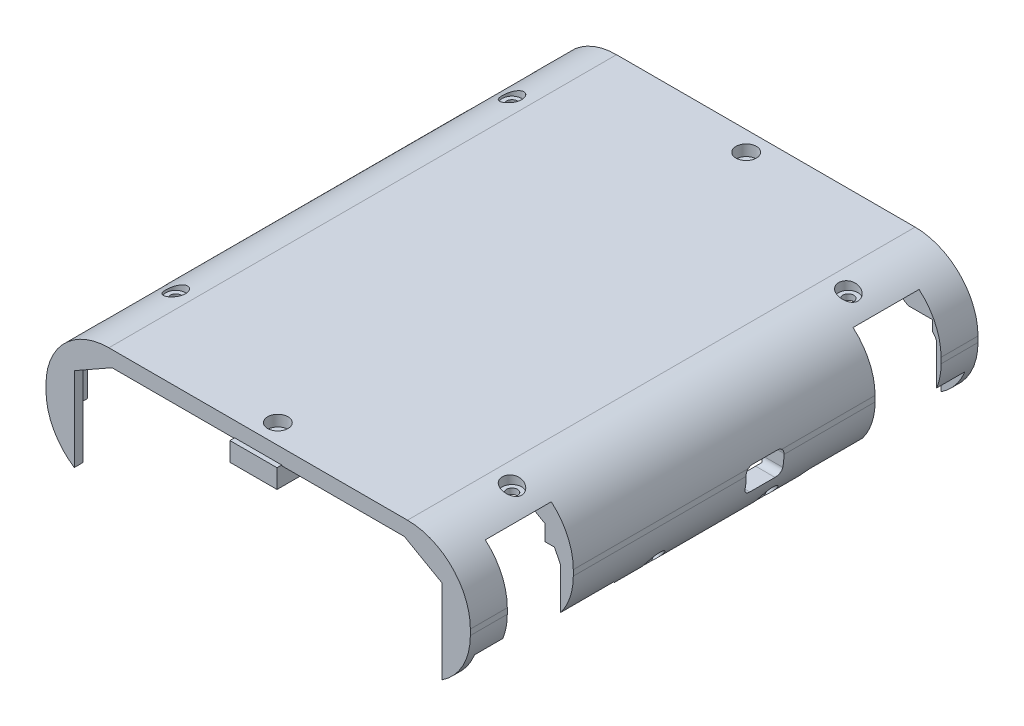
from build123d import *

# Parameters (mm, degrees)
BOSS_EXTRUDE1_DEPTH = 161.5
SKETCH11_W          = 21
SKETCH11_H          = 33.7
CUT_EXTRUDE7_DEPTH  = 214.141971465
CUT_EXTRUDE8_REACH  = 181.223
SKETCH12_R          = 1.75
SKETCH14_R          = 3.1
CUT_EXTRUDE9_DEPTH  = 3
CUT_EXTRUDE10_DEPTH = 9
BOSS_EXTRUDE5_DEPTH = 6
CUT_EXTRUDE11_REACH = 179.217
SKETCH20_R          = 1.75
SKETCH22_R          = 3.25
CUT_EXTRUDE12_DEPTH = 3.5
CUT_EXTRUDE13_START = -15
CUT_EXTRUDE13_DEPTH = 15
CHAMFER1_SIZE       = 7
MIRROR1_START       = -34
MIRROR1_OUTLINE_W   = 7.588235294
MIRROR1_OUTLINE_H   = 9
MIRROR1_DEPTH       = 18.20203721
MIRROR1_START_2     = -16.8
MIRROR1_2_OUTLINE_W = 6.338235294
MIRROR1_2_OUTLINE_H = 9
MIRROR1_2_DEPTH     = 10.8
MIRROR1_START_3     = 1.5
MIRROR1_3_OUTLINE_R = 3.25
MIRROR1_3_DEPTH     = 4.5
MIRROR1_4_OUTLINE_W = 1.25
MIRROR1_4_OUTLINE_H = 9
MIRROR1_4_DEPTH     = 5.4
MIRROR1_5_OUTLINE_R = 1.75
MIRROR1_5_DEPTH     = 1.5
MIRROR1_START_4     = -5.8
MIRROR1_6_OUTLINE_R = 1.75
MIRROR1_6_DEPTH     = 6
MIRROR1_START_5     = 32.75
MIRROR1_7_DEPTH     = 22
MIRROR1_START_6     = 149.75
MIRROR1_8_DEPTH     = 9
MIRROR1_START_7     = -15.79796279
MIRROR1_9_DEPTH     = 3.99796279
SKETCH24_W          = 32
SKETCH24_H          = 27
CUT_EXTRUDE14_DEPTH = 3
FILLET1_R           = 3
SKETCH25_W          = 8
SKETCH25_H          = 5
BOSS_EXTRUDE6_DEPTH = 8
CUT_EXTRUDE15_REACH = 119.19
CUT_EXTRUDE17_REACH = 216.281
SKETCH27_R          = 1.6
SKETCH28_R          = 3
CUT_EXTRUDE18_DEPTH = 7
SKETCH31_W          = 42
SKETCH31_H          = 65
CUT_EXTRUDE19_DEPTH = 6.8
SKETCH34_R          = 3
SKETCH34_W          = 6
SKETCH34_H          = 8.65
BOSS_EXTRUDE7_DEPTH = 3.5
SKETCH37_R          = 1.05
CUT_EXTRUDE21_DEPTH = 6.2
CUT_EXTRUDE22_DEPTH = 2
CUT_EXTRUDE23_REACH = 210.728
SKETCH40_W          = 12
SKETCH40_H          = 8
CHAMFER2_SIZE       = 2
FILLET2_R           = 2
SKETCH41_W          = 50
SKETCH41_H          = 4
SKETCH41_H_2        = 10
CUT_EXTRUDE24_DEPTH = 3.5
FILLET3_R           = 3.5
SKETCH43_R          = 3.5
BOSS_EXTRUDE8_DEPTH = 3
CUT_EXTRUDE28_REACH = 184.576
CUT_EXTRUDE28_START = 3
SKETCH48_W          = 11.5
SKETCH48_H          = 72
SKETCH44_R          = 2
CUT_EXTRUDE26_DEPTH = 5
CUT_EXTRUDE27_REACH = 210.728
SKETCH45_W          = 20
SKETCH45_H          = 8
CHAMFER3_SIZE       = 2
FILLET4_R           = 2
SKETCH46_R          = 2.75
SKETCH46_R_2        = 2.1
BOSS_EXTRUDE9_DEPTH = 2.3


with BuildPart() as part:
    # Sketch9 → Boss-Extrude1 (new body)
    with BuildSketch(Plane.XY):
        with BuildLine():
            Line((-47.5, 5), (47.5, 5))
            ThreePointArc((47.5, 5), (61.642135624, -0.857864376), (67.5, -15))
            Line((67.5, -15), (67.5, -16.8))
            ThreePointArc((67.5, -16.8), (65.106767147, -26.285383493), (58.5, -33.5))
            Line((58.5, -33.5), (58.5, -6.8))
            Line((58.5, -6.8), (46.5, 0))
            Line((46.5, 0), (-46.5, 0))
            Line((-46.5, 0), (-58.5, -6.8))
            Line((-58.5, -6.8), (-58.5, -33.5))
            ThreePointArc((-58.5, -33.5), (-65.106767147, -26.285383493), (-67.5, -16.8))
            Line((-67.5, -16.8), (-67.5, -15))
            ThreePointArc((-67.5, -15), (-61.642135624, -0.857864376), (-47.5, 5))
        make_face()
    extrude(amount=BOSS_EXTRUDE1_DEPTH)

    # Sketch11 → Cut-Extrude7 (cut, through all)
    with BuildSketch(Plane.ZY.offset(67.5)):
        with Locations((139.25, -16.65)):
            Rectangle(SKETCH11_W, SKETCH11_H)
        with Locations((22.25, -16.65)):
            Rectangle(SKETCH11_W, SKETCH11_H)
    extrude(amount=-CUT_EXTRUDE7_DEPTH, mode=Mode.SUBTRACT)

    # Sketch12 → Cut-Extrude8 (cut, up to next)
    with BuildSketch(Plane(origin=(0, 5, 0), x_dir=(1, 0, 0), z_dir=(0, 1, 0)), mode=Mode.PRIVATE) as cut_extrude8_sk1:
        with Locations(Location((-53.5, -134.25, 0), (0, 0, 270))):
            Circle(SKETCH12_R)
    cut_extrude8_tool1 = extrude(cut_extrude8_sk1.sketch, amount=-CUT_EXTRUDE8_REACH, mode=Mode.PRIVATE) & part.part
    # Sketch12 → Cut-Extrude8 (cut, up to next)
    with BuildSketch(Plane(origin=(0, 5, 0), x_dir=(1, 0, 0), z_dir=(0, 1, 0)), mode=Mode.PRIVATE) as cut_extrude8_sk2:
        with Locations(Location((-53.5, -27.25, 0), (0, 0, 270))):
            Circle(SKETCH12_R)
    cut_extrude8_tool2 = extrude(cut_extrude8_sk2.sketch, amount=-CUT_EXTRUDE8_REACH, mode=Mode.PRIVATE) & part.part
    # Sketch12 → Cut-Extrude8 (cut, up to next)
    with BuildSketch(Plane(origin=(0, 5, 0), x_dir=(1, 0, 0), z_dir=(0, 1, 0)), mode=Mode.PRIVATE) as cut_extrude8_sk3:
        with Locations(Location((53.5, -27.25, 0), (0, 0, 270))):
            Circle(SKETCH12_R)
    cut_extrude8_tool3 = extrude(cut_extrude8_sk3.sketch, amount=-CUT_EXTRUDE8_REACH, mode=Mode.PRIVATE) & part.part
    # Sketch12 → Cut-Extrude8 (cut, up to next)
    with BuildSketch(Plane(origin=(0, 5, 0), x_dir=(1, 0, 0), z_dir=(0, 1, 0)), mode=Mode.PRIVATE) as cut_extrude8_sk4:
        with Locations(Location((53.5, -134.25, 0), (0, 0, 270))):
            Circle(SKETCH12_R)
    cut_extrude8_tool4 = extrude(cut_extrude8_sk4.sketch, amount=-CUT_EXTRUDE8_REACH, mode=Mode.PRIVATE) & part.part
    add(cut_extrude8_tool1.solids().sort_by_distance((-53.5, 5, 134.25))[0], mode=Mode.SUBTRACT)
    add(cut_extrude8_tool2.solids().sort_by_distance((-53.5, 5, 27.25))[0], mode=Mode.SUBTRACT)
    add(cut_extrude8_tool3.solids().sort_by_distance((53.5, 5, 27.25))[0], mode=Mode.SUBTRACT)
    add(cut_extrude8_tool4.solids().sort_by_distance((53.5, 5, 134.25))[0], mode=Mode.SUBTRACT)

    # Sketch14 → Cut-Extrude9 (cut)
    with BuildSketch(Plane(origin=(0, 5, 0), x_dir=(1, 0, 0), z_dir=(0, 1, 0))):
        with Locations(Location((-53.5, -134.25, 0), (0, 0, 270))):
            Circle(SKETCH14_R)
        with Locations(Location((-53.5, -27.25, 0), (0, 0, 270))):
            Circle(SKETCH14_R)
        with Locations(Location((53.5, -27.25, 0), (0, 0, 270))):
            Circle(SKETCH14_R)
        with Locations(Location((53.5, -134.25, 0), (0, 0, 270))):
            Circle(SKETCH14_R)
    extrude(amount=-CUT_EXTRUDE9_DEPTH, mode=Mode.SUBTRACT)

    # Sketch16 → Cut-Extrude10 (cut)
    with BuildSketch(Plane.XY.offset(11.75)):
        with BuildLine():
            Line((57.088235294, -33.5), (66.088235294, -33.5))
            Line((66.088235294, -33.5), (66.088235294, -11.4))
            ThreePointArc((66.088235294, -11.4), (65.636772566, -10.291539205), (64.838235294, -9.4))
            Line((64.838235294, -9.4), (64.838235294, -6))
            Line((64.838235294, -6), (57.088235294, -6))
            Line((57.088235294, -6), (57.088235294, -33.5))
        make_face()
        with BuildLine():
            Line((-66.088235294, -33.5), (-66.088235294, -11.4))
            ThreePointArc((-66.088235294, -11.4), (-65.636772566, -10.291539205), (-64.838235294, -9.4))
            Line((-64.838235294, -9.4), (-64.838235294, -6))
            Line((-64.838235294, -6), (-57.088235294, -6))
            Line((-57.088235294, -6), (-57.088235294, -33.5))
            Line((-57.088235294, -33.5), (-66.088235294, -33.5))
        make_face()
    extrude(amount=-CUT_EXTRUDE10_DEPTH, mode=Mode.SUBTRACT)

    # Sketch19 → Boss-Extrude5 (add)
    with BuildSketch(Plane.XZ.offset(-0.2)):
        Polygon((-11.248461447, 25.25), (11.251538553, 25.25), (11.251538553, 12.25), (7.501538553, 12.25), (7.501538553, -1.5), (-7.498461447, -1.5), (-7.498461447, 12.25), (-11.248461447, 12.25), align=None)
    extrude(amount=BOSS_EXTRUDE5_DEPTH)

    # Sketch20 → Cut-Extrude11 (cut, up to next)
    with BuildSketch(Plane.XZ.offset(5.8), mode=Mode.PRIVATE) as cut_extrude11_sk1:
        with Locations(Location((0.001538553, 6.25, 0), (0, 0, 270))):
            Circle(SKETCH20_R)
    cut_extrude11_tool1 = extrude(cut_extrude11_sk1.sketch, amount=-CUT_EXTRUDE11_REACH, mode=Mode.PRIVATE) & part.part
    add(cut_extrude11_tool1.solids().sort_by_distance((0.001539, -5.8, 6.25))[0], mode=Mode.SUBTRACT)

    # Sketch22 → Cut-Extrude12 (cut)
    with BuildSketch(Plane(origin=(0, 5, 0), x_dir=(1, 0, 0), z_dir=(0, 1, 0))):
        with Locations(Location((0.001538553, -6.25, 0), (0, 0, 270))):
            Circle(SKETCH22_R)
    extrude(amount=-CUT_EXTRUDE12_DEPTH, mode=Mode.SUBTRACT)

    # Sketch23 → Cut-Extrude13 (cut)
    with BuildSketch(Plane.XY.offset(128.75).offset(CUT_EXTRUDE13_START)):
        with BuildLine():
            Line((-58.5, -11.8), (-58.5, -33.5))
            ThreePointArc((-58.5, -33.5), (-61.203275994, -31.365138759), (-63.5, -28.79796279))
            Line((-63.5, -28.79796279), (-63.5, -15.79796279))
            Line((-63.5, -15.79796279), (-61.5, -11.8))
            Line((-61.5, -11.8), (-58.5, -11.8))
        make_face()
        with BuildLine():
            Line((63.5, -15.79796279), (63.5, -28.79796279))
            ThreePointArc((63.5, -28.79796279), (61.203275994, -31.365138759), (58.5, -33.5))
            Line((58.5, -33.5), (58.5, -11.8))
            Line((58.5, -11.8), (61.5, -11.8))
            Line((61.5, -11.8), (63.5, -15.79796279))
        make_face()
    extrude(amount=CUT_EXTRUDE13_DEPTH, mode=Mode.SUBTRACT)

    # Chamfer1
    # the kernel refuses this chamfer: 7 mm, written as the material it takes off along each edge
    with BuildSketch(Plane(origin=(-58.5, -11.8, 113.75), x_dir=(0, 0, -1), z_dir=(0, -1, 0))) as chamfer1_piece_1_section:
        Polygon((CHAMFER1_SIZE, 0), (0, -CHAMFER1_SIZE), (0, 0), align=None)
    chamfer1_piece_1 = extrude(amount=39.701780916, mode=Mode.PRIVATE)
    chamfer1_piece_1 = split(chamfer1_piece_1, bisect_by=Plane(origin=(-60.899510796, -10.599633252, 113.75), z_dir=(0.8943360284912045, -0.4473958740786281, 0)), keep=Keep.TOP, mode=Mode.PRIVATE)
    chamfer1_piece_1 = split(chamfer1_piece_1, bisect_by=Plane(origin=(-63.5, -11.8, 113.75), z_dir=(1, 0, 0)), keep=Keep.TOP, mode=Mode.PRIVATE)
    add(chamfer1_piece_1, mode=Mode.SUBTRACT)
    with BuildSketch(Plane(origin=(58.5, -51.501780916, 113.75), x_dir=(0, 0, -1), z_dir=(0, 1, 0))) as chamfer1_piece_2_section:
        Polygon((CHAMFER1_SIZE, 0), (0, -CHAMFER1_SIZE), (0, 0), align=None)
    chamfer1_piece_2 = extrude(amount=39.701780916, mode=Mode.PRIVATE)
    chamfer1_piece_2 = split(chamfer1_piece_2, bisect_by=Plane(origin=(63.5, -51.501780916, 113.75), z_dir=(-1, 0, 0)), keep=Keep.TOP, mode=Mode.PRIVATE)
    chamfer1_piece_2 = split(chamfer1_piece_2, bisect_by=Plane(origin=(76.785076672, -42.354583889, 113.75), z_dir=(-0.8943360284912032, -0.4473958740786306, 0)), keep=Keep.TOP, mode=Mode.PRIVATE)
    add(chamfer1_piece_2, mode=Mode.SUBTRACT)

    # Mirror1: read off the stored shape, not the designer's step
    # Mirror1 outline → Mirror1 (cut)
    with BuildSketch(Plane(origin=(0, 0, 0), x_dir=(1, 0, 0), z_dir=(0, 1, 0)).offset(MIRROR1_START)):
        with Locations((62.294117647, -154.25)):
            Rectangle(MIRROR1_OUTLINE_W, MIRROR1_OUTLINE_H)
        with Locations((-62.294117647, -154.25)):
            Rectangle(MIRROR1_OUTLINE_W, MIRROR1_OUTLINE_H)
        Polygon((-58.5, -54.75), (-58.5, -32.75), (-63.5, -32.75), (-63.5, -49.75), align=None)
        Polygon((63.5, -49.75), (63.5, -32.75), (58.5, -32.75), (58.5, -54.75), align=None)
    extrude(amount=MIRROR1_DEPTH, mode=Mode.SUBTRACT)

    # Mirror1 2 outline → Mirror1 2 (cut)
    with BuildSketch(Plane(origin=(0, 0, 0), x_dir=(1, 0, 0), z_dir=(0, 1, 0)).offset(MIRROR1_START_2)):
        with Locations((61.669117647, -154.25)):
            Rectangle(MIRROR1_2_OUTLINE_W, MIRROR1_2_OUTLINE_H)
        with Locations((-61.669117647, -154.25)):
            Rectangle(MIRROR1_2_OUTLINE_W, MIRROR1_2_OUTLINE_H)
    extrude(amount=MIRROR1_2_DEPTH, mode=Mode.SUBTRACT)

    # Mirror1 3 outline → Mirror1 3 (cut)
    with BuildSketch(Plane(origin=(0, 0, 0), x_dir=(1, 0, 0), z_dir=(0, 1, 0)).offset(MIRROR1_START_3)):
        with Locations((0.001538553, -155.25)):
            Circle(MIRROR1_3_OUTLINE_R)
    extrude(amount=MIRROR1_3_DEPTH, mode=Mode.SUBTRACT)

    # Mirror1 4 outline → Mirror1 4 (cut)
    with BuildSketch(Plane(origin=(0, 0, 0), x_dir=(1, 0, 0), z_dir=(0, 1, 0)).offset(MIRROR1_START_2)):
        with Locations((-65.463235294, -154.25)):
            Rectangle(MIRROR1_4_OUTLINE_W, MIRROR1_4_OUTLINE_H)
        with Locations((65.463235294, -154.25)):
            Rectangle(MIRROR1_4_OUTLINE_W, MIRROR1_4_OUTLINE_H)
    extrude(amount=MIRROR1_4_DEPTH, mode=Mode.SUBTRACT)

    # Mirror1 5 outline → Mirror1 5 (cut)
    with BuildSketch(Plane(origin=(0, 0, 0), x_dir=(1, 0, 0), z_dir=(0, 1, 0))):
        with Locations((0.001538553, -155.25)):
            Circle(MIRROR1_5_OUTLINE_R)
    extrude(amount=MIRROR1_5_DEPTH, mode=Mode.SUBTRACT)

    # Mirror1 6 outline → Mirror1 6 (add)
    with BuildSketch(Plane(origin=(0, 0, 0), x_dir=(1, 0, 0), z_dir=(0, 1, 0)).offset(MIRROR1_START_4)):
        Polygon((-7.498461447, -149.25), (-7.498461447, -163), (7.501538553, -163), (7.501538553, -149.25), (11.251538553, -149.25), (11.251538553, -136.25), (-11.248461447, -136.25), (-11.248461447, -149.25), align=None)
        with Locations((0.001538553, -155.25)):
            Circle(MIRROR1_6_OUTLINE_R, mode=Mode.SUBTRACT)
    extrude(amount=MIRROR1_6_DEPTH)

    # Mirror1 7 outline → Mirror1 7 (cut)
    with BuildSketch(Plane.XY.offset(MIRROR1_START_5)):
        Polygon((-58.5, -15.79796279), (-58.5, -11.8), (-61.5, -11.8), (-63.5, -15.79796279), align=None)
        Polygon((61.5, -11.8), (58.5, -11.8), (58.5, -15.79796279), (63.5, -15.79796279), align=None)
    extrude(amount=MIRROR1_7_DEPTH, mode=Mode.SUBTRACT)

    # Mirror1 8 outline → Mirror1 8 (cut)
    with BuildSketch(Plane.XY.offset(MIRROR1_START_6)):
        Polygon((-57.088235294, -6), (-58.5, -6), (-58.5, -6.8), align=None)
        with BuildLine():
            ThreePointArc((-64.838235294, -9.4), (-65.636772566, -10.291539205), (-66.088235294, -11.4))
            Line((-66.088235294, -11.4), (-64.838235294, -11.4))
            Line((-64.838235294, -11.4), (-64.838235294, -9.4))
        make_face()
        with BuildLine():
            ThreePointArc((66.088235294, -11.4), (65.636772566, -10.291539205), (64.838235294, -9.4))
            Line((64.838235294, -9.4), (64.838235294, -11.4))
            Line((64.838235294, -11.4), (66.088235294, -11.4))
        make_face()
        Polygon((58.5, -6), (57.088235294, -6), (58.5, -6.8), align=None)
    extrude(amount=MIRROR1_8_DEPTH, mode=Mode.SUBTRACT)

    # Mirror1 9 outline → Mirror1 9 (add)
    with BuildSketch(Plane(origin=(0, 0, 0), x_dir=(1, 0, 0), z_dir=(0, 1, 0)).offset(MIRROR1_START_7)):
        Polygon((65, -48.25), (58.5, -54.75), (65, -54.75), align=None)
        Polygon((-58.5, -54.75), (-65, -48.25), (-65, -54.75), align=None)
    extrude(amount=MIRROR1_9_DEPTH)

    # Sketch24 → Cut-Extrude14 (cut)
    with BuildSketch(Plane.XZ):
        with Locations((0, 86.75)):
            Rectangle(SKETCH24_W, SKETCH24_H)
    extrude(amount=-CUT_EXTRUDE14_DEPTH, mode=Mode.SUBTRACT)

    # Fillet1
    fillet1_edges = [part.edges().sort_by_distance(p)[0] for p in [
        (-16, 3, 86.75),
        (16, 3, 86.75),
    ]]
    fillet(fillet1_edges, radius=FILLET1_R - 0.0001)  # a hair under: the kernel refuses the full size

    # Sketch25 → Boss-Extrude6 (add)
    with BuildSketch(Plane.XZ):
        with Locations((17, 70.75)):
            Rectangle(SKETCH25_W, SKETCH25_H)
        with Locations((-17, 70.75)):
            Rectangle(SKETCH25_W, SKETCH25_H)
    boss_extrude6 = extrude(amount=BOSS_EXTRUDE6_DEPTH)

    # Sketch26 → Cut-Extrude15 (cut, up to next)
    with BuildSketch(Plane.XY.offset(73.25), mode=Mode.PRIVATE) as cut_extrude15_sk1:
        Polygon((21, -1), (21, -8), (15.5, -8), align=None)
    cut_extrude15_tool1 = extrude(cut_extrude15_sk1.sketch, amount=-CUT_EXTRUDE15_REACH, mode=Mode.PRIVATE) & part.part
    # Sketch26 → Cut-Extrude15 (cut, up to next)
    with BuildSketch(Plane.XY.offset(73.25), mode=Mode.PRIVATE) as cut_extrude15_sk2:
        Polygon((-15.5, -8), (-21, -1), (-21, -8), align=None)
    cut_extrude15_tool2 = extrude(cut_extrude15_sk2.sketch, amount=-CUT_EXTRUDE15_REACH, mode=Mode.PRIVATE) & part.part
    cut_extrude15_1 = cut_extrude15_tool1.solids().sort_by_distance((19.166667, -5.666667, 73.25))[0]
    add(cut_extrude15_1, mode=Mode.SUBTRACT)
    cut_extrude15_2 = cut_extrude15_tool2.solids().sort_by_distance((-19.166667, -5.666667, 73.25))[0]
    add(cut_extrude15_2, mode=Mode.SUBTRACT)
    cut_extrude15 = cut_extrude15_1 + cut_extrude15_2  # Cut-Extrude15 as one shape, for the pattern or mirror that repeats it

    # Mirror2: Boss-Extrude6, Cut-Extrude15 across plane
    add(boss_extrude6.mirror(Plane.XY.offset(86.75)))
    add(cut_extrude15.mirror(Plane.XY.offset(86.75)), mode=Mode.SUBTRACT)

    # Sketch27 → Cut-Extrude17 (cut, up to next)
    with BuildSketch(Plane(origin=(67.5, 0, 0), x_dir=(0, 0, -1), z_dir=(1, 0, 0)), mode=Mode.PRIVATE) as cut_extrude17_sk1:
        with Locations(Location((-98.75, -29.5, 0), (0, 0, 90))):
            Circle(SKETCH27_R)
    cut_extrude17_tool1 = extrude(cut_extrude17_sk1.sketch, amount=-CUT_EXTRUDE17_REACH, mode=Mode.PRIVATE) & part.part
    # Sketch27 → Cut-Extrude17 (cut, up to next)
    with BuildSketch(Plane(origin=(67.5, 0, 0), x_dir=(0, 0, -1), z_dir=(1, 0, 0)), mode=Mode.PRIVATE) as cut_extrude17_sk2:
        with Locations(Location((-62.75, -29.5, 0), (0, 0, 90))):
            Circle(SKETCH27_R)
    cut_extrude17_tool2 = extrude(cut_extrude17_sk2.sketch, amount=-CUT_EXTRUDE17_REACH, mode=Mode.PRIVATE) & part.part
    cut_extrude17_1 = cut_extrude17_tool1.solids().sort_by_distance((67.5, -29.5, 98.75))[0]
    add(cut_extrude17_1, mode=Mode.SUBTRACT)
    cut_extrude17_2 = cut_extrude17_tool2.solids().sort_by_distance((67.5, -29.5, 62.75))[0]
    add(cut_extrude17_2, mode=Mode.SUBTRACT)
    cut_extrude17 = cut_extrude17_1 + cut_extrude17_2  # Cut-Extrude17 as one shape, for the pattern or mirror that repeats it

    # Sketch28 → Cut-Extrude18 (cut)
    with BuildSketch(Plane(origin=(67.5, 0, 0), x_dir=(0, 0, -1), z_dir=(1, 0, 0))):
        with Locations((-98.75, -29.5)):
            Circle(SKETCH28_R)
        with Locations((-62.75, -29.5)):
            Circle(SKETCH28_R)
    cut_extrude18 = extrude(amount=-CUT_EXTRUDE18_DEPTH, mode=Mode.SUBTRACT)

    # Mirror3: Cut-Extrude17, Cut-Extrude18 across plane
    add(cut_extrude17.mirror(Plane(origin=(0, 0, 0), x_dir=(0, 0, 1), z_dir=(1, 0, 0))), mode=Mode.SUBTRACT)
    add(cut_extrude18.mirror(Plane(origin=(0, 0, 0), x_dir=(0, 0, 1), z_dir=(1, 0, 0))), mode=Mode.SUBTRACT)

    # Sketch31 → Cut-Extrude19 (cut)
    with BuildSketch(Plane.XZ):
        with Locations((37.5, 80.75)):
            Rectangle(SKETCH31_W, SKETCH31_H)
    extrude(amount=CUT_EXTRUDE19_DEPTH, mode=Mode.SUBTRACT)

    # Sketch34 → Boss-Extrude7 (add)
    with BuildSketch(Plane.XZ):
        with Locations(Location((19.5, 108.6, 0), (0, 0, 90))):
            Circle(SKETCH34_R)
        with Locations(Location((19.5, 52.9, 0), (0, 0, 90))):
            Circle(SKETCH34_R)
        with Locations((55.5, 108.925)):
            Rectangle(SKETCH34_W, SKETCH34_H)
        with Locations((55.5, 52.575)):
            Rectangle(SKETCH34_W, SKETCH34_H)
    extrude(amount=BOSS_EXTRUDE7_DEPTH)

    # Sketch37 → Cut-Extrude21 (cut)
    with BuildSketch(Plane.XZ.offset(3.5)):
        with Locations(Location((19.5, 108.6, 0), (0, 0, 270))):
            Circle(SKETCH37_R)
        with Locations(Location((19.5, 52.9, 0), (0, 0, 270))):
            Circle(SKETCH37_R)
        with Locations(Location((55.549682172, 108.6, 0), (0, 0, 270))):
            Circle(SKETCH37_R)
        with Locations(Location((55.549682172, 52.9, 0), (0, 0, 270))):
            Circle(SKETCH37_R)
    extrude(amount=-CUT_EXTRUDE21_DEPTH, mode=Mode.SUBTRACT)

    # Sketch38 → Cut-Extrude22 (cut)
    with BuildSketch(Plane.XZ):
        with BuildLine():
            Line((21.632580596, 110.71), (18.281790932, 110.71))
            Line((18.281790932, 110.71), (17.063581864, 108.6))
            Line((17.063581864, 108.6), (18.281790932, 106.49))
            Line((18.281790932, 106.49), (21.632580596, 106.49))
            ThreePointArc((21.632580596, 106.49), (22.5, 108.6), (21.632580596, 110.71))
        make_face()
        Polygon((56.76789124, 106.49), (52.5, 106.49), (52.5, 110.71), (56.76789124, 110.71), (57.986100308, 108.6), align=None)
        Polygon((52.5, 50.79), (56.76789124, 50.79), (57.986100308, 52.9), (56.76789124, 55.01), (52.5, 55.01), align=None)
        with BuildLine():
            Line((18.281790932, 55.01), (21.632580596, 55.01))
            ThreePointArc((21.632580596, 55.01), (22.5, 52.9), (21.632580596, 50.79))
            Line((21.632580596, 50.79), (18.281790932, 50.79))
            Line((18.281790932, 50.79), (17.063581864, 52.9))
            Line((17.063581864, 52.9), (18.281790932, 55.01))
        make_face()
    extrude(amount=CUT_EXTRUDE22_DEPTH, mode=Mode.SUBTRACT)

    # Sketch40 → Cut-Extrude23 (cut, up to next)
    with BuildSketch(Plane.ZY.offset(-58.5), mode=Mode.PRIVATE) as cut_extrude23_sk1:
        with Locations((67.75, -18.5)):
            Rectangle(SKETCH40_W, SKETCH40_H)
    cut_extrude23_tool1 = extrude(cut_extrude23_sk1.sketch, amount=-CUT_EXTRUDE23_REACH, mode=Mode.PRIVATE) & part.part
    add(cut_extrude23_tool1.solids().sort_by_distance((58.5, -18.5, 67.75))[0], mode=Mode.SUBTRACT)

    # Chamfer2
    chamfer2_edges = [part.edges().sort_by_distance(p)[0] for p in [
        (58.5, -18.5, 73.75),
        (58.5, -14.5, 67.75),
        (58.5, -18.5, 61.75),
        (58.5, -22.5, 67.75),
    ]]
    chamfer(chamfer2_edges, length=CHAMFER2_SIZE)

    # Fillet2
    fillet2_edges = [part.edges().sort_by_distance(p)[0] for p in [
        (63.996874512, -14.5, 73.75),
        (63.585142918, -22.5, 73.75),
        (63.585142918, -22.5, 61.75),
        (63.996874512, -14.5, 61.75),
    ]]
    fillet(fillet2_edges, radius=FILLET2_R)

    # Sketch41 → Cut-Extrude24 (cut)
    with BuildSketch(Plane.XZ):
        with Locations((0, 120.75)):
            Rectangle(SKETCH41_W, SKETCH41_H)
        with Locations((0, 113.75)):
            Rectangle(SKETCH41_W, SKETCH41_H)
        with Locations((0, 41.25)):
            Rectangle(SKETCH41_W, SKETCH41_H_2)
    extrude(amount=-CUT_EXTRUDE24_DEPTH, mode=Mode.SUBTRACT)

    # Fillet3
    fillet3_edges = [part.edges().sort_by_distance(p)[0] for p in [
        (-25, 3.5, 113.75),
        (-25, 3.5, 120.75),
        (25, 3.5, 113.75),
        (25, 3.5, 120.75),
    ]]
    fillet(fillet3_edges, radius=FILLET3_R - 0.0001)  # a hair under: the kernel refuses the full size

    # Sketch43 → Boss-Extrude8 (add)
    with BuildSketch(Plane.XZ):
        with Locations((-54.5, 111.75)):
            Circle(SKETCH43_R)
        with Locations((-54.5, 49.75)):
            Circle(SKETCH43_R)
        with Locations(Location((-23.6, 49.75, 0), (0, 0, 270))):
            Circle(SKETCH43_R)
    extrude(amount=BOSS_EXTRUDE8_DEPTH)

    # Sketch48 → Cut-Extrude28 (cut, up to next)
    with BuildSketch(Plane.XZ.offset(CUT_EXTRUDE28_START), mode=Mode.PRIVATE) as cut_extrude28_sk1:
        with Locations((-52.25, 80.75)):
            Rectangle(SKETCH48_W, SKETCH48_H)
    cut_extrude28_tool1 = extrude(cut_extrude28_sk1.sketch, amount=CUT_EXTRUDE28_REACH, mode=Mode.PRIVATE) & part.part
    add(cut_extrude28_tool1.solids().sort_by_distance((-52.25, -3, 80.75))[0], mode=Mode.SUBTRACT)

    # Sketch44 → Cut-Extrude26 (cut)
    with BuildSketch(Plane.XZ.offset(3)):
        with Locations(Location((-54.5, 111.75, 0), (0, 0, 270))):
            Circle(SKETCH44_R)
        with Locations(Location((-54.5, 49.75, 0), (0, 0, 270))):
            Circle(SKETCH44_R)
        with Locations(Location((-23.6, 49.75, 0), (0, 0, 270))):
            Circle(SKETCH44_R)
    extrude(amount=-CUT_EXTRUDE26_DEPTH, mode=Mode.SUBTRACT)

    # Sketch45 → Cut-Extrude27 (cut, up to next)
    with BuildSketch(Plane(origin=(-58.5, 0, 0), x_dir=(0, 0, -1), z_dir=(1, 0, 0)), mode=Mode.PRIVATE) as cut_extrude27_sk1:
        with Locations((-83.25, -13)):
            Rectangle(SKETCH45_W, SKETCH45_H)
    cut_extrude27_tool1 = extrude(cut_extrude27_sk1.sketch, amount=-CUT_EXTRUDE27_REACH, mode=Mode.PRIVATE) & part.part
    add(cut_extrude27_tool1.solids().sort_by_distance((-58.5, -13, 83.25))[0], mode=Mode.SUBTRACT)

    # Chamfer3
    chamfer3_edges = [part.edges().sort_by_distance(p)[0] for p in [
        (-58.5, -13, 93.25),
        (-58.5, -17, 83.25),
        (-58.5, -13, 73.25),
        (-58.5, -9, 83.25),
    ]]
    chamfer(chamfer3_edges, length=CHAMFER3_SIZE)

    # Fillet4
    fillet4_edges = [part.edges().sort_by_distance(p)[0] for p in [
        (-63.999499835, -17, 73.25),
        (-63.999499835, -17, 93.25),
        (-63.539392014, -9, 93.25),
        (-63.539392014, -9, 73.25),
    ]]
    fillet(fillet4_edges, radius=FILLET4_R)

    # Sketch46 → Boss-Extrude9 (add)
    # profile 1 of 3: a face of its own
    with BuildSketch(Plane.XZ.offset(3)):
        with Locations(Location((-54.5, 111.75, 0), (0, 0, 270))):
            Circle(SKETCH46_R)
        with Locations(Location((-54.5, 111.75, 0), (0, 0, 270))):
            Circle(SKETCH46_R_2, mode=Mode.SUBTRACT)
    # profile 2 of 3: a face of its own
    with BuildSketch(Plane.XZ.offset(3)):
        with Locations(Location((-54.5, 49.75, 0), (0, 0, 270))):
            Circle(SKETCH46_R)
        with Locations(Location((-54.5, 49.75, 0), (0, 0, 270))):
            Circle(SKETCH46_R_2, mode=Mode.SUBTRACT)
    # profile 3 of 3: a face of its own
    with BuildSketch(Plane.XZ.offset(3)):
        with Locations(Location((-23.6, 49.75, 0), (0, 0, 270))):
            Circle(SKETCH46_R)
        with Locations(Location((-23.6, 49.75, 0), (0, 0, 270))):
            Circle(SKETCH46_R_2, mode=Mode.SUBTRACT)
    extrude(amount=BOSS_EXTRUDE9_DEPTH)


solid = part.part
